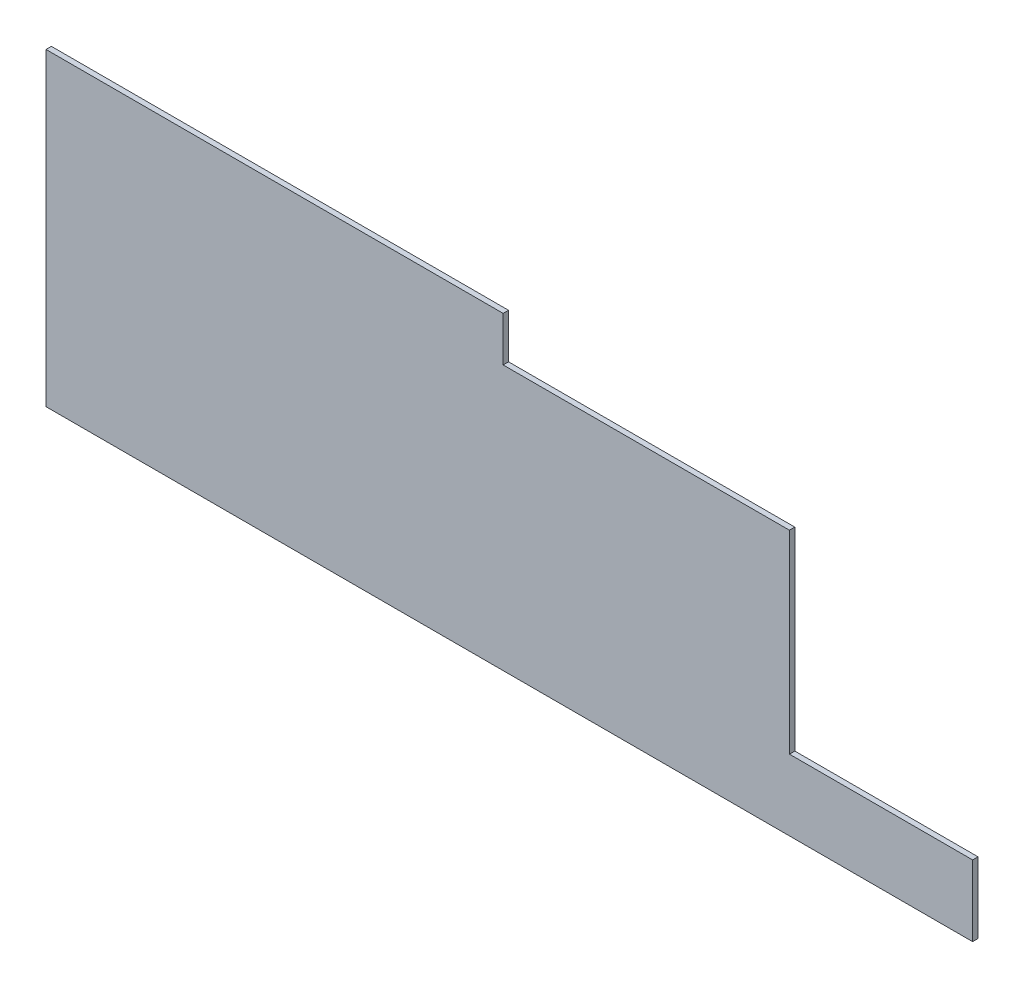
from build123d import *

# Parameters (mm, degrees)
TABAN_FLAN_1_DEPTH         = 35
KES_EKSTR_ZYON1_DEPTH      = 6347.788558003
KES_EKSTR_ZYON1_DEPTH_BACK = 6347.788558003
IZIM2_W                    = 360
IZIM2_H                    = 1260
KES_EKSTR_ZYON2_DEPTH      = 6347.788558003
KES_EKSTR_ZYON2_DEPTH_BACK = 6347.788558003
IZIM3_W                    = 570
IZIM3_H                    = 1260
IZIM3_W_2                  = 5
IZIM3_H_2                  = 290
KES_EKSTR_ZYON3_DEPTH      = 6347.788558003
KES_EKSTR_ZYON3_DEPTH_BACK = 6347.788558003
IZIM4_W                    = 260
IZIM4_H                    = 1260


# Sheet-metal steps are written as plain solids
with BuildPart() as part:
    # Çizim1 → Taban-Flanş1 (new body)
    with BuildSketch(Plane.XY):
        Polygon((0, 0), (0, 1720), (-3045, 1720), (-3045, 2010), (-6020, 2010), (-6020, 0), align=None)
    extrude(amount=-TABAN_FLAN_1_DEPTH)

    # Çizim2 → Kes-Ekstrüzyon1 (cut, two sides: drawn at the far end of the back side and taken through both)
    with BuildSketch(Plane.XY.offset(-KES_EKSTR_ZYON1_DEPTH_BACK)):
        with Locations((-180, 1090)):
            Rectangle(IZIM2_W, IZIM2_H)
    extrude(amount=KES_EKSTR_ZYON1_DEPTH + KES_EKSTR_ZYON1_DEPTH_BACK, mode=Mode.SUBTRACT)

    # Çizim3 → Kes-Ekstrüzyon2 (cut, two sides: drawn at the far end of the back side and taken through both)
    with BuildSketch(Plane.XY.offset(-KES_EKSTR_ZYON2_DEPTH_BACK)):
        with Locations((-645, 1090)):
            Rectangle(IZIM3_W, IZIM3_H)
        with Locations((-3047.5, 1865)):
            Rectangle(IZIM3_W_2, IZIM3_H_2)
    extrude(amount=KES_EKSTR_ZYON2_DEPTH + KES_EKSTR_ZYON2_DEPTH_BACK, mode=Mode.SUBTRACT)

    # Çizim4 → Kes-Ekstrüzyon3 (cut, two sides: drawn at the far end of the back side and taken through both)
    with BuildSketch(Plane.XY.offset(-KES_EKSTR_ZYON3_DEPTH_BACK)):
        with Locations((-1060, 1090)):
            Rectangle(IZIM4_W, IZIM4_H)
    extrude(amount=KES_EKSTR_ZYON3_DEPTH + KES_EKSTR_ZYON3_DEPTH_BACK, mode=Mode.SUBTRACT)


solid = part.part
